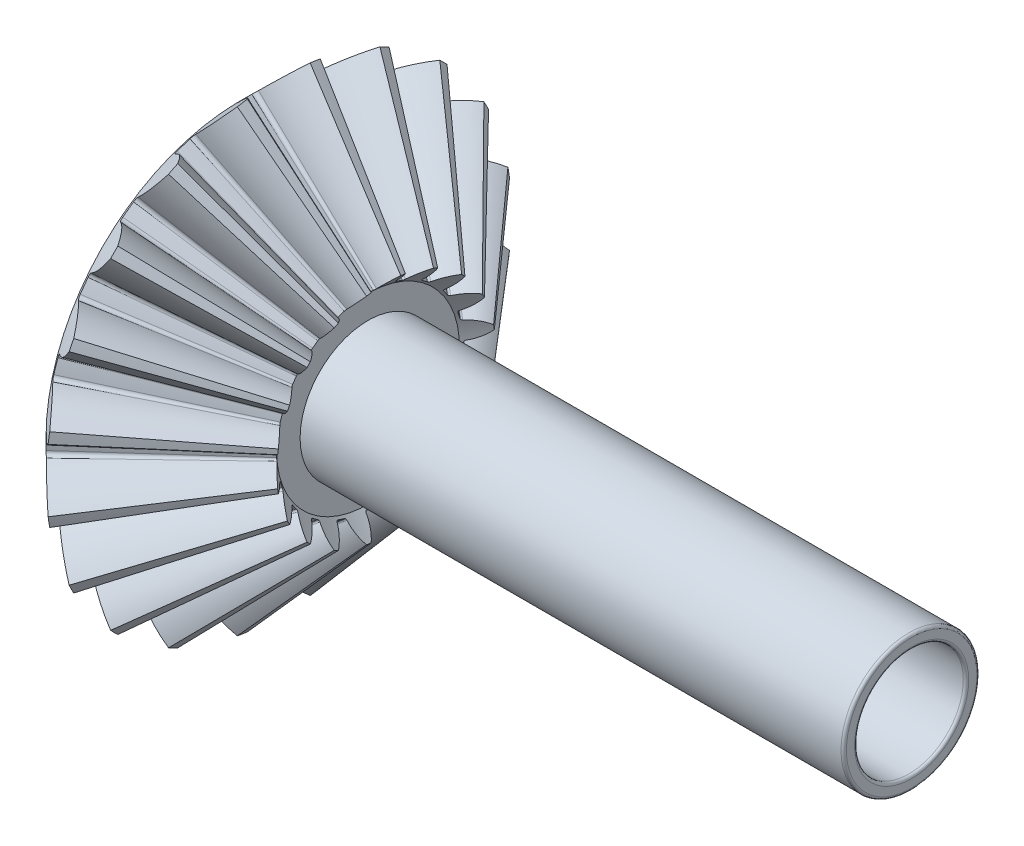
from build123d import *

# Parameters (mm, degrees)
TEETHCUTS_COUNT         = 20
TEETHCUTS_ANGLE         = 342
HUBSKE_R                = 5
HUB_DEPTH               = 0.0001016
BORSKE_R                = 1.5
BORE_DEPTH              = 8.84097754
CROQUIS1_R              = 2.5
CROQUIS1_R_2            = 2
SALIENTE_EXTRUIR1_DEPTH = 20
REDONDEO3_R             = 0.1
REDONDEO4_R             = 0.1


with BuildPart() as part:
    # BasProSke → Base-Revolve (revolve)
    with BuildSketch(Plane(origin=(0, 0, 0), x_dir=(1, 0, 0), z_dir=(0, 1, 0)), mode=Mode.PRIVATE) as base_revolve_sk:
        Polygon((0, 0), (0, 7.159073261), (1.406612166, 8.565685424), (5.349252849, 4.023044734), (4.688609434, 3.36240132), (4.688609434, 0), align=None)
    revolve(base_revolve_sk.sketch.rotate(Axis((-10, 0, 0), (1, 0, 0)), 180), axis=Axis((-10, 0, 0), (1, 0, 0)))

    # ToothCut: read off the stored shape, not the designer's step
    # ToothCut: loft between two sections, ruled curve by curve
    toothcut_from = [
        Edge.make_bspline([(8.846968182, 0.006041442, -0.009396371), (8.842747294, 0.001820554, -0.014824058), (8.837070599, -0.003856141, -0.014022911), (8.833691402, -0.007235338, -0.007522631)], [0, 0, 0, 0, 1, 1, 1, 1], 3, [1, 0.779607321, 0.779607321, 1]),
        Edge.make_bspline([(8.833691402, -0.007235338, 0.007522631), (8.837070599, -0.003856141, 0.014022911), (8.842747294, 0.001820554, 0.014824058), (8.846968182, 0.006041442, 0.009396371)], [0, 0, 0, 0, 1, 1, 1, 1], 3, [1, 0.779607321, 0.779607321, 1]),
        Edge.make_bspline([(8.833691402, -0.007235338, -0.007522631), (8.833188772, -0.007737968, -0.006555763), (8.832787408, -0.008139332, -0.005498444), (8.832495307, -0.008431433, -0.00437174)], [0, 0, 0, 0, 1, 1, 1, 1], 3, [1, 0.993359051, 0.993359051, 1]),
        Edge.make_bspline([(8.832495307, -0.008431433, 0.00437174), (8.832787408, -0.008139332, 0.005498444), (8.833188772, -0.007737968, 0.006555763), (8.833691402, -0.007235338, 0.007522631)], [0, 0, 0, 0, 1, 1, 1, 1], 3, [1, 0.993359051, 0.993359051, 1]),
        Edge.make_bspline([(8.832495307, -0.008431433, -0.00437174), (8.831755763, -0.009170977, -0.001519142), (8.831755763, -0.009170977, 0.001519142), (8.832495307, -0.008431433, 0.00437174)], [0, 0, 0, 0, 1, 1, 1, 1], 3, [1, 0.959256539, 0.959256539, 1]),
        Edge.make_line((8.846968182, 0.006041442, 0.009396371), (8.846968182, 0.006041442, -0.009396371)),
    ]
    toothcut_to = [
        Edge.make_bspline([(1.46556069, 8.624633948, -1.28623016), (1.133128031, 8.29220129, -0.817842922), (0.716323315, 7.875396575, -0.512954078), (0.25391972, 7.412992981, -0.399925851)], [0, 0, 0, 0, 1, 1, 1, 1], 3, [1, 0.968991732, 0.968991732, 1]),
        Edge.make_bspline([(0.25391972, 7.412992981, 0.399925851), (0.716323315, 7.875396575, 0.512954078), (1.133128031, 8.29220129, 0.817842922), (1.46556069, 8.624633948, 1.28623016)], [0, 0, 0, 0, 1, 1, 1, 1], 3, [1, 0.968991732, 0.968991732, 1]),
        Edge.make_bspline([(0.25391972, 7.412992981, -0.399925851), (0.198607772, 7.357681033, -0.386405603), (0.16320738, 7.322280641, -0.324800046), (0.165162164, 7.324235425, -0.245465452)], [0, 0, 0, 0, 1, 1, 1, 1], 3, [1, 0.835749277, 0.835749277, 1]),
        Edge.make_bspline([(0.165162164, 7.324235425, 0.245465452), (0.16320738, 7.322280641, 0.324800046), (0.198607772, 7.357681033, 0.386405603), (0.25391972, 7.412992981, 0.399925851)], [0, 0, 0, 0, 1, 1, 1, 1], 3, [1, 0.835749277, 0.835749277, 1]),
        Edge.make_bspline([(0.165162164, 7.324235425, -0.245465452), (0.169193484, 7.328266745, -0.081854918), (0.169193484, 7.328266745, 0.081854918), (0.165162164, 7.324235425, 0.245465452)], [0, 0, 0, 0, 1, 1, 1, 1], 3, [1, 0.999595624, 0.999595624, 1]),
        Edge.make_line((1.46556069, 8.624633948, 1.28623016), (1.46556069, 8.624633948, -1.28623016)),
    ]
    toothcut = Solid(Shell([*[Face.make_surface_from_curves(toothcut_from[k], toothcut_to[k]) for k in range(6)], Face(Wire(toothcut_from)), Face(Wire(toothcut_to))]))
    add(toothcut, mode=Mode.SUBTRACT)

    # TeethCuts: ToothCut ×20 about axis
    teethcuts_axis = Axis((-10, 0, 0), (1, 0, 0))
    for i in range(1, TEETHCUTS_COUNT):
        add(toothcut.rotate(teethcuts_axis, i * TEETHCUTS_ANGLE / (TEETHCUTS_COUNT - 1)), mode=Mode.SUBTRACT)

    # HubSke → Hub (add)
    with BuildSketch(Plane.ZY):
        with Locations(Location((0, 0, 0), (0, 0, 180))):
            Circle(HUBSKE_R)
    extrude(amount=HUB_DEPTH)

    # BorSke → Bore (cut, symmetric)
    with BuildSketch(Plane(origin=(0, 0, 0), x_dir=(0, 0, -1), z_dir=(1, 0, 0))):
        with Locations(Location((0, 0, 0), (0, 0, 180))):
            Circle(BORSKE_R)
    extrude(amount=BORE_DEPTH, both=True, mode=Mode.SUBTRACT)

    # Croquis1 → Saliente-Extruir1 (add)
    with BuildSketch(Plane(origin=(4.688609434, 0, 0), x_dir=(0, 0, -1), z_dir=(1, 0, 0))):
        with Locations(Location((0, 0, 0), (0, 0, 180))):
            Circle(CROQUIS1_R)
        Circle(CROQUIS1_R_2, mode=Mode.SUBTRACT)
    extrude(amount=SALIENTE_EXTRUIR1_DEPTH)

    # Redondeo3
    redondeo3_edges = [part.edges().sort_by_distance(p)[0] for p in [
        (24.688609434, 0, 2),
    ]]
    fillet(redondeo3_edges, radius=REDONDEO3_R)

    # Redondeo4
    redondeo4_edges = [part.edges().sort_by_distance(p)[0] for p in [
        (24.688609434, 0, -2.5),
    ]]
    fillet(redondeo4_edges, radius=REDONDEO4_R)


solid = part.part
